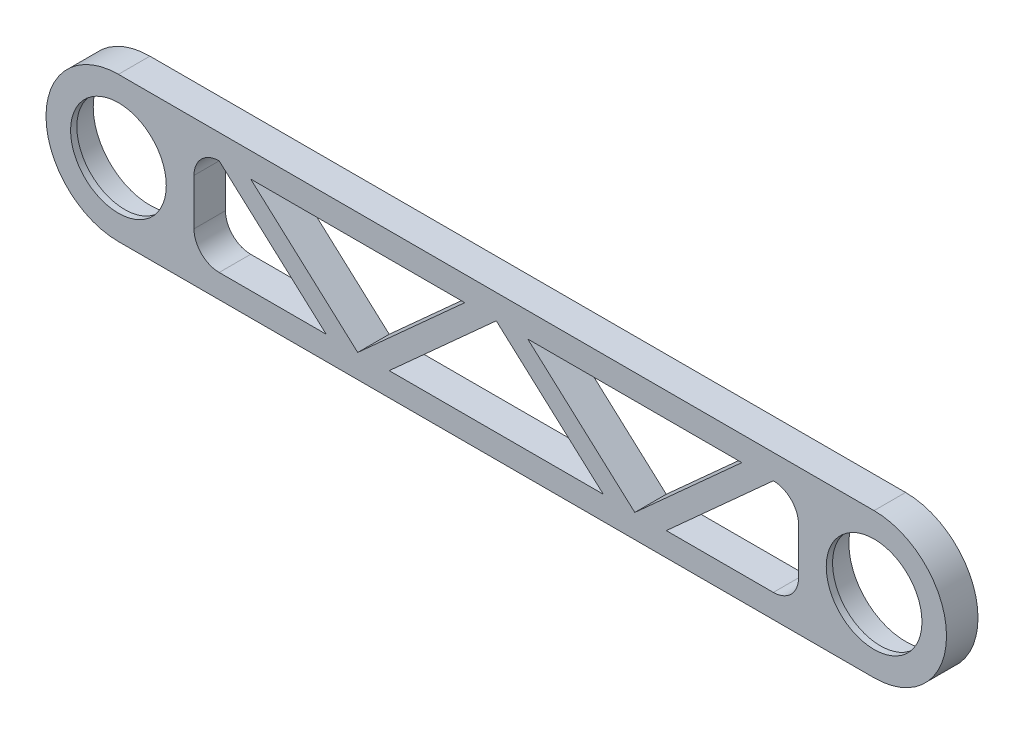
from build123d import *

# Parameters (mm, degrees)
BOSS_EXTRUDE3_DEPTH     = 5
SKETCH6_R               = 9
CUT_EXTRUDE3_DEPTH      = 4
BOSS_EXTRUDE4_START     = -1
BOSS_EXTRUDE4_OUTLINE_R = 7.6
BOSS_EXTRUDE4_DEPTH     = 1
BOSS_EXTRUDE5_START     = -4
BOSS_EXTRUDE5_OUTLINE_R = 9
BOSS_EXTRUDE5_DEPTH     = 4
BOSS_EXTRUDE6_START     = -1
BOSS_EXTRUDE6_OUTLINE_R = 7.6
BOSS_EXTRUDE6_DEPTH     = 1
CUT_EXTRUDE8_DEPTH      = 20
BOSS_EXTRUDE8_DEPTH     = 5
BOSS_EXTRUDE9_DEPTH     = 5
CUT_EXTRUDE10_DEPTH     = 10


# Read off the part's stored shape, not the designer's step: Boss-Extrude4, Boss-Extrude5, Boss-Extrude6
with BuildPart() as part:
    # Sketch5 → Boss-Extrude3 (new body)
    with BuildSketch(Plane.XY):
        with BuildLine():
            Line((0, 11.5), (120, 11.5))
            ThreePointArc((120, 11.5), (131.5, 0), (120, -11.5))
            Line((120, -11.5), (0, -11.5))
            ThreePointArc((0, -11.5), (-11.5, 0), (0, 11.5))
        make_face()
    extrude(amount=BOSS_EXTRUDE3_DEPTH)

    # Sketch6 → Cut-Extrude3 (cut)
    with BuildSketch(Plane(origin=(0, 0, 0), x_dir=(-1, 0, 0), z_dir=(0, 0, -1))):
        Circle(SKETCH6_R)
    extrude(amount=-CUT_EXTRUDE3_DEPTH, mode=Mode.SUBTRACT)

    # Boss-Extrude4 outline → Boss-Extrude4 (cut)
    with BuildSketch(Plane(origin=(0, 0, 4), x_dir=(-1, 0, 0), z_dir=(0, 0, -1)).offset(BOSS_EXTRUDE4_START)):
        Circle(BOSS_EXTRUDE4_OUTLINE_R)
    extrude(amount=BOSS_EXTRUDE4_DEPTH, mode=Mode.SUBTRACT)

    # Boss-Extrude5 outline → Boss-Extrude5 (cut)
    with BuildSketch(Plane(origin=(0, 0, 0), x_dir=(-1, 0, 0), z_dir=(0, 0, -1)).offset(BOSS_EXTRUDE5_START)):
        with Locations((-120, 0)):
            Circle(BOSS_EXTRUDE5_OUTLINE_R)
    extrude(amount=BOSS_EXTRUDE5_DEPTH, mode=Mode.SUBTRACT)

    # Boss-Extrude6 outline → Boss-Extrude6 (cut)
    with BuildSketch(Plane(origin=(0, 0, 4), x_dir=(-1, 0, 0), z_dir=(0, 0, -1)).offset(BOSS_EXTRUDE6_START)):
        with Locations((-120, 0)):
            Circle(BOSS_EXTRUDE6_OUTLINE_R)
    extrude(amount=BOSS_EXTRUDE6_DEPTH, mode=Mode.SUBTRACT)

    # Sketch12 → Cut-Extrude8 (cut)
    with BuildSketch(Plane.XY.offset(5)):
        with BuildLine():
            Line((16, 7.6), (104, 7.6))
            ThreePointArc((104, 7.6), (106.828427125, 6.428427125), (108, 3.6))
            Line((108, 3.6), (108, -3.748914736))
            ThreePointArc((108, -3.748914736), (106.828427125, -6.577341861), (104, -7.748914736))
            Line((104, -7.748914736), (16, -7.748914736))
            ThreePointArc((16, -7.748914736), (13.171572875, -6.577341861), (12, -3.748914736))
            Line((12, -3.748914736), (12, 3.6))
            ThreePointArc((12, 3.6), (13.171572875, 6.428427125), (16, 7.6))
        make_face()
    extrude(amount=-CUT_EXTRUDE8_DEPTH, mode=Mode.SUBTRACT)

    # Sketch12<10> → Boss-Extrude8 (add)
    with BuildSketch(Plane.XY.offset(5)):
        Polygon((38, -7.748914736), (21, 7.6), (16, 7.6), (33, -7.748914736), align=None)
        Polygon((60, 7.6), (55, 7.6), (38, -7.748914736), (43, -7.748914736), align=None)
        Polygon((65, 7.6), (60, 7.6), (77, -7.748914736), (82, -7.748914736), align=None)
        Polygon((104, 7.6), (99, 7.6), (82, -7.748914736), (87, -7.748914736), align=None)
    extrude(amount=-BOSS_EXTRUDE8_DEPTH)

    # Sketch12<11> → Boss-Extrude9 (add)
    with BuildSketch(Plane.XY.offset(5)):
        with BuildLine():
            ThreePointArc((108, 3.6), (106.828427125, 6.428427125), (104, 7.6))
            Line((104, 7.6), (87, -7.748914736))
            Line((87, -7.748914736), (104, -7.748914736))
            ThreePointArc((104, -7.748914736), (106.828427125, -6.577341861), (108, -3.748914736))
            Line((108, -3.748914736), (108, 3.6))
        make_face()
    extrude(amount=-BOSS_EXTRUDE9_DEPTH)

    # Sketch12<14> → Cut-Extrude10 (cut)
    with BuildSketch(Plane.XY.offset(5)):
        with BuildLine():
            ThreePointArc((108, 3.6), (106.828427125, 6.428427125), (104, 7.6))
            Line((104, 7.6), (87, -7.748914736))
            Line((87, -7.748914736), (104, -7.748914736))
            ThreePointArc((104, -7.748914736), (106.828427125, -6.577341861), (108, -3.748914736))
            Line((108, -3.748914736), (108, 3.6))
        make_face()
    extrude(amount=-CUT_EXTRUDE10_DEPTH, mode=Mode.SUBTRACT)


solid = part.part
